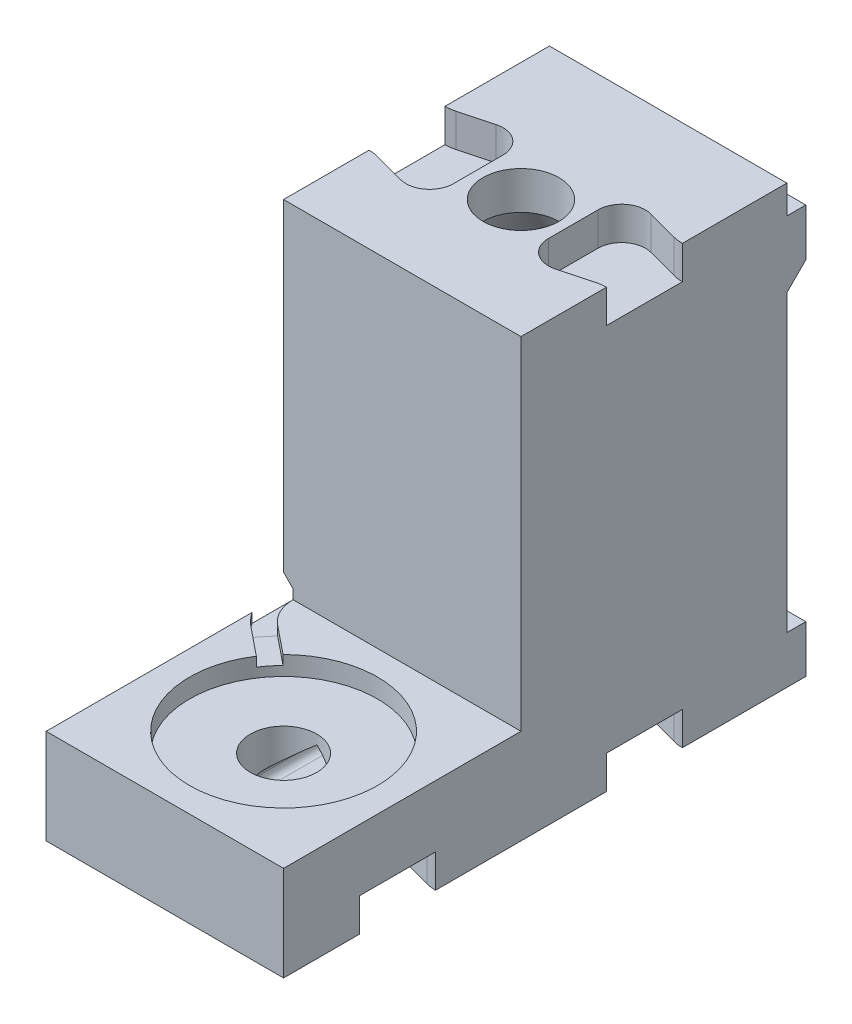
from build123d import *

# Parameters (mm, degrees)
SKETCH2_W                                = 25
SKETCH2_H                                = 53
BOSS_EXTRUDE1_DEPTH                      = 10
SKETCH4_R                                = 9.9
CUT_EXTRUDE3_DEPTH                       = 2
SKETCH5_R                                = 3.5
CUT_EXTRUDE4_DEPTH                       = 5
CUT_EXTRUDE6_REACH                       = 34.253
CUT_EXTRUDE6_END_RADIUS                  = 3.5
CUT_EXTRUDE6_DIRECTION_2_DEPTH           = 12.5
FILLET1_R                                = 0.75
FILLET2_R                                = 0.75
SKETCH9_W                                = 25
SKETCH9_H                                = 28
BOSS_EXTRUDE2_DEPTH                      = 36
FILLET3_R                                = 0.75
FILLET4_R                                = 2
SKETCH12_W                               = 2
SKETCH12_H                               = 2
CUT_EXTRUDE7_DEPTH                       = 2
CHAMFER1_SIZE                            = 1
SKETCH17_W                               = 4
SKETCH17_H                               = 2
SKETCH17_W_2                             = 8
CUT_EXTRUDE9_DEPTH                       = 2
CHAMFER2_SIZE                            = 2
CUT_EXTRUDE10_DEPTH                      = 3.5
MIRROR1_AT_THE_SECOND_PLANE_COPY_1_DEPTH = 3.5
MIRROR2_COPY_1_DEPTH                     = 3.5
MIRROR2_COPY_2_DEPTH                     = 3.5
MIRROR2_COPY_3_DEPTH                     = 3.5
MIRROR2_COPY_4_DEPTH                     = 3.5
BOSS_EXTRUDE3_DEPTH                      = 2
BOSS_EXTRUDE4_DEPTH                      = 2.4
BOSS_EXTRUDE5_DEPTH                      = 5
CHAMFER4_SIZE                            = 0.5


# Some blends are built 0.0001 mm under size
with BuildPart() as part:
    # Sketch2 → Boss-Extrude1 (new body)
    with BuildSketch(Plane(origin=(0, 0, 0), x_dir=(1, 0, 0), z_dir=(0, 1, 0))):
        with Locations((0, 1.5)):
            Rectangle(SKETCH2_W, SKETCH2_H)
    extrude(amount=-BOSS_EXTRUDE1_DEPTH)

    # Sketch4 → Cut-Extrude3 (cut)
    with BuildSketch(Plane(origin=(0, 0, 0), x_dir=(1, 0, 0), z_dir=(0, 1, 0))):
        with Locations(Location((0, -12.5, 0), (0, 0, 270))):
            Circle(SKETCH4_R)
    extrude(amount=-CUT_EXTRUDE3_DEPTH, mode=Mode.SUBTRACT)

    # Sketch5 → Cut-Extrude4 (cut)
    with BuildSketch(Plane(origin=(0, -2, 0), x_dir=(1, 0, 0), z_dir=(0, 1, 0))):
        with Locations(Location((0, -12.5, 0), (0, 0, 270))):
            Circle(SKETCH5_R)
    extrude(amount=-CUT_EXTRUDE4_DEPTH, mode=Mode.SUBTRACT)

    # Cut-Extrude6: up to this cylinder (the profile starts outside it)
    cut_extrude6_end = Plane(origin=(0, -5.592254, 12.5), z_dir=(0, 1, 0)) * Cylinder(CUT_EXTRUDE6_END_RADIUS, 76.506, mode=Mode.PRIVATE)
    # Sketch6 → Cut-Extrude6 (cut, up to the surface)
    with BuildSketch(Plane.XY, mode=Mode.PRIVATE) as cut_extrude6_sk1:
        Polygon((0, -3), (-3.5, -5.936848709), (-3.5, -7), (3.5, -7), (3.5, -5.936848709), align=None)
    cut_extrude6_tool1 = extrude(cut_extrude6_sk1.sketch, amount=CUT_EXTRUDE6_REACH, mode=Mode.PRIVATE) - cut_extrude6_end
    add(cut_extrude6_tool1.solids().sort_by_distance((0, -5.592254, 0))[0], mode=Mode.SUBTRACT)

    # Sketch6 → Cut-Extrude6 direction 2 (cut)
    with BuildSketch(Plane.XY):
        Polygon((0, -3), (-3.5, -5.936848709), (-3.5, -7), (3.5, -7), (3.5, -5.936848709), align=None)
    extrude(amount=-CUT_EXTRUDE6_DIRECTION_2_DEPTH, mode=Mode.SUBTRACT)

    # Sketch8 → Cut-Revolve1 (revolve, cut)
    with BuildSketch(Plane(origin=(0, 0, 0), x_dir=(0, 0, -1), z_dir=(1, 0, 0))):
        Polygon((12.5, 0), (12.5, -7), (16, -7), (16, -2), (22.5, 0), align=None)
    revolve(axis=Axis((0, -8.247089088, -12.5), (0, 1, 0)), mode=Mode.SUBTRACT)

    # Fillet1
    fillet1_edges = [part.edges().sort_by_distance(p)[0] for p in [
        (2.474873734, -7, 14.974873734),
        (-3.5, -7, 0),
        (3.5, -7, 0),
        (2.474873734, -7, -14.974873734),
    ]]
    fillet(fillet1_edges, radius=FILLET1_R)

    # Fillet2
    # the kernel refuses this fillet: 0.75 mm, written as the material it adds along each edge
    with BuildSketch(Plane(origin=(3.5, -5.936848709, -13.374326859), x_dir=(0, -1, 0), z_dir=(0, 0, 1))) as fillet2_piece_1_section:
        with BuildLine():
            CenterArc((FILLET2_R * 0.466307658155, -FILLET2_R), FILLET2_R, 90, 50)
            Line((-FILLET2_R * 0.299736784964, -FILLET2_R * 0.357212390313), (0, 0))
            Line((0, 0), (FILLET2_R * 0.466307658155, 0))
        make_face()
    fillet2_piece_1 = extrude(amount=26.748653718, mode=Mode.PRIVATE)
    fillet2_piece_1 = fillet2_piece_1 - Plane(origin=(0, -5.969679039, -12.5), x_dir=(0, 0, -1), z_dir=(0, 1, 0)) * Cylinder(3.5, 55, mode=Mode.PRIVATE)
    fillet2_piece_1 = fillet2_piece_1 - Plane(origin=(0, -5.969679039, 12.5), x_dir=(0, 0, 1), z_dir=(0, 1, 0)) * Cylinder(3.5, 55, mode=Mode.PRIVATE)
    add(fillet2_piece_1)
    with BuildSketch(Plane(origin=(-3.5, -5.936848709, -13.374326859), x_dir=(0.7660444431189801, 0.6427876096865369, 0), z_dir=(0, 0, 1))) as fillet2_piece_2_section:
        with BuildLine():
            CenterArc((FILLET2_R * 0.466307658155, -FILLET2_R), FILLET2_R, 90, 50)
            Line((-FILLET2_R * 0.299736784964, -FILLET2_R * 0.357212390313), (0, 0))
            Line((0, 0), (FILLET2_R * 0.466307658155, 0))
        make_face()
    fillet2_piece_2 = extrude(amount=26.748653718, mode=Mode.PRIVATE)
    fillet2_piece_2 = fillet2_piece_2 - Plane(origin=(0, -5.96967914, -12.5), x_dir=(0, 0, -1), z_dir=(0, 1, 0)) * Cylinder(3.5, 55, mode=Mode.PRIVATE)
    fillet2_piece_2 = fillet2_piece_2 - Plane(origin=(0, -5.96967914, 12.5), x_dir=(0, 0, 1), z_dir=(0, 1, 0)) * Cylinder(3.5, 55, mode=Mode.PRIVATE)
    add(fillet2_piece_2)

    # Sketch9 → Boss-Extrude2 (add)
    with BuildSketch(Plane(origin=(0, 0, 0), x_dir=(1, 0, 0), z_dir=(0, 1, 0))):
        with Locations((0, 14)):
            Rectangle(SKETCH9_W, SKETCH9_H)
    extrude(amount=BOSS_EXTRUDE2_DEPTH)

    # Sketch10 → Cut-Revolve2 (revolve, cut)
    with BuildSketch(Plane(origin=(0, 0, 0), x_dir=(0, 0, -1), z_dir=(1, 0, 0))):
        Polygon((12.5, 0), (12.5, 36), (16.5, 36), (16.5, 32), (22.5, 21.607695155), (22.5, 0), align=None)
    revolve(axis=Axis((0, -8.247089088, -12.5), (0, 1, 0)), mode=Mode.SUBTRACT)

    # Fillet3
    fillet3_edges = [part.edges().sort_by_distance(p)[0] for p in [
        (0, -2, -9),
    ]]
    fillet(fillet3_edges, radius=FILLET3_R)

    # Fillet4
    fillet4_edges = [part.edges().sort_by_distance(p)[0] for p in [
        (0, 0, -2.5),
        (0, 21.607695155, -2.5),
    ]]
    fillet(fillet4_edges, radius=FILLET4_R)

    # Cut-Sweep1: sweep along a path in Sketch11
    with BuildLine(Plane(origin=(0, 0, 0), x_dir=(1, 0, 0), z_dir=(0, 1, 0))) as cut_sweep1_path:
        Line((-12.5, 28), (-12.5, 0))
        ThreePointArc((-12.5, 0), (-12.012487896, -2.153474631), (-10.645018805, -3.887011283))
        Line((-10.645018805, -3.887011283), (0, -12.5))
    # Sketch12 → Cut-Sweep1 (sweep, cut)
    with BuildSketch(Plane(origin=(0, 0, -28), x_dir=(-1, 0, 0), z_dir=(0, 0, -1))):
        with Locations((12.5, 0)):
            Rectangle(SKETCH12_W, SKETCH12_H)
    sweep(path=cut_sweep1_path.line, mode=Mode.SUBTRACT)

    # Sketch14 → Cut-Extrude7 (cut)
    with BuildSketch(Plane(origin=(0, 0, -28), x_dir=(-1, 0, 0), z_dir=(0, 0, -1))):
        with BuildLine():
            Line((-10.1, -7), (-2.15, -7))
            ThreePointArc((-2.15, -7), (0, -9.15), (2.15, -7))
            Line((2.15, -7), (10.1, -7))
            Line((10.1, -7), (10.1, 20.85))
            ThreePointArc((10.1, 20.85), (12.25, 23), (10.1, 25.15))
            Line((10.1, 25.15), (10.1, 33))
            Line((10.1, 33), (-10.1, 33))
            Line((-10.1, 33), (-10.1, 25.15))
            ThreePointArc((-10.1, 25.15), (-12.25, 23), (-10.1, 20.85))
            Line((-10.1, 20.85), (-10.1, -7))
        make_face()
    extrude(amount=-CUT_EXTRUDE7_DEPTH, mode=Mode.SUBTRACT)

    # Chamfer1
    chamfer1_edges = [part.edges().sort_by_distance(p)[0] for p in [
        (-12.5, 1, -14),
    ]]
    chamfer(chamfer1_edges, length=CHAMFER1_SIZE - 0.0001)  # a hair under: the kernel refuses the full size

    # Sketch17 → Cut-Extrude9 (cut)
    with BuildSketch(Plane(origin=(0, 0, -26), x_dir=(-1, 0, 0), z_dir=(0, 0, -1))):
        with Locations((0, -2.5)):
            Rectangle(SKETCH17_W, SKETCH17_H)
        with Locations((0, 29.5)):
            Rectangle(SKETCH17_W_2, SKETCH17_H)
    extrude(amount=-CUT_EXTRUDE9_DEPTH, mode=Mode.SUBTRACT)

    # Chamfer2
    chamfer2_edges = [part.edges().sort_by_distance(p)[0] for p in [
        (0, -1.5, -26),
        (0, 30.5, -26),
        (0, 33, -28),
    ]]
    chamfer(chamfer2_edges, length=CHAMFER2_SIZE - 0.0001)  # a hair under: the kernel refuses the full size

    # Sketch18 → Cut-Extrude10 (cut)
    with BuildSketch(Plane.XZ.offset(10)):
        with BuildLine():
            Line((-11.46472382, 8.863703305), (-8.147047613, 7.974734645))
            ThreePointArc((-8.147047613, 7.974734645), (-5.978096427, 8.40616586), (-5, 10.389549211))
            Line((-5, 10.389549211), (-5, 15.610450789))
            ThreePointArc((-5, 15.610450789), (-5.978096427, 17.59383414), (-8.147047613, 18.025265355))
            Line((-8.147047613, 18.025265355), (-11.46472382, 17.136296695))
            ThreePointArc((-11.46472382, 17.136296695), (-11.977895231, 17.034220555), (-12.5, 17))
            Line((-12.5, 17), (-12.5, 9))
            ThreePointArc((-12.5, 9), (-11.977895231, 8.965779445), (-11.46472382, 8.863703305))
        make_face()
    cut_extrude10 = extrude(amount=-CUT_EXTRUDE10_DEPTH, mode=Mode.SUBTRACT)

    # Mirror1: Cut-Extrude10 across plane
    add(cut_extrude10.mirror(Plane.XY), mode=Mode.SUBTRACT)

    # Mirror1 at the second plane: Cut-Extrude10 across plane
    add(cut_extrude10.mirror(Plane(origin=(0, 0, 0), x_dir=(0, 0, 1), z_dir=(1, 0, 0))), mode=Mode.SUBTRACT)

    # Mirror1 at the second plane copy 1 sketc → Mirror1 at the second plane copy 1 (cut)
    with BuildSketch(Plane(origin=(0, -10, 0), x_dir=(-1, 0, 0), z_dir=(0, -1, 0))):
        with BuildLine():
            Line((-11.46472382, 8.863703305), (-8.147047613, 7.974734645))
            ThreePointArc((-8.147047613, 7.974734645), (-5.978096427, 8.40616586), (-5, 10.389549211))
            Line((-5, 10.389549211), (-5, 15.610450789))
            ThreePointArc((-5, 15.610450789), (-5.978096427, 17.59383414), (-8.147047613, 18.025265355))
            Line((-8.147047613, 18.025265355), (-11.46472382, 17.136296695))
            ThreePointArc((-11.46472382, 17.136296695), (-11.977895231, 17.034220555), (-12.5, 17))
            Line((-12.5, 17), (-12.5, 9))
            ThreePointArc((-12.5, 9), (-11.977895231, 8.965779445), (-11.46472382, 8.863703305))
        make_face()
    extrude(amount=-MIRROR1_AT_THE_SECOND_PLANE_COPY_1_DEPTH, mode=Mode.SUBTRACT)

    # Mirror2 copy 1 sketch → Mirror2 copy 1 (cut)
    with BuildSketch(Plane(origin=(0, 36, 0), x_dir=(1, 0, 0), z_dir=(0, 1, 0))):
        with BuildLine():
            Line((-11.46472382, 8.863703305), (-8.147047613, 7.974734645))
            ThreePointArc((-8.147047613, 7.974734645), (-5.978096427, 8.40616586), (-5, 10.389549211))
            Line((-5, 10.389549211), (-5, 15.610450789))
            ThreePointArc((-5, 15.610450789), (-5.978096427, 17.59383414), (-8.147047613, 18.025265355))
            Line((-8.147047613, 18.025265355), (-11.46472382, 17.136296695))
            ThreePointArc((-11.46472382, 17.136296695), (-11.977895231, 17.034220555), (-12.5, 17))
            Line((-12.5, 17), (-12.5, 9))
            ThreePointArc((-12.5, 9), (-11.977895231, 8.965779445), (-11.46472382, 8.863703305))
        make_face()
    extrude(amount=-MIRROR2_COPY_1_DEPTH, mode=Mode.SUBTRACT)

    # Mirror2 copy 2 sketch → Mirror2 copy 2 (cut)
    with BuildSketch(Plane(origin=(0, 36, 0), x_dir=(-1, 0, 0), z_dir=(0, 1, 0))):
        with BuildLine():
            Line((-11.46472382, 8.863703305), (-8.147047613, 7.974734645))
            ThreePointArc((-8.147047613, 7.974734645), (-5.978096427, 8.40616586), (-5, 10.389549211))
            Line((-5, 10.389549211), (-5, 15.610450789))
            ThreePointArc((-5, 15.610450789), (-5.978096427, 17.59383414), (-8.147047613, 18.025265355))
            Line((-8.147047613, 18.025265355), (-11.46472382, 17.136296695))
            ThreePointArc((-11.46472382, 17.136296695), (-11.977895231, 17.034220555), (-12.5, 17))
            Line((-12.5, 17), (-12.5, 9))
            ThreePointArc((-12.5, 9), (-11.977895231, 8.965779445), (-11.46472382, 8.863703305))
        make_face()
    extrude(amount=-MIRROR2_COPY_2_DEPTH, mode=Mode.SUBTRACT)

    # Mirror2 copy 3 sketch → Mirror2 copy 3 (cut)
    with BuildSketch(Plane(origin=(0, 36, 0), x_dir=(-1, 0, 0), z_dir=(0, 1, 0))):
        with BuildLine():
            Line((-11.46472382, -8.863703305), (-8.147047613, -7.974734645))
            ThreePointArc((-8.147047613, -7.974734645), (-5.978096427, -8.40616586), (-5, -10.389549211))
            Line((-5, -10.389549211), (-5, -15.610450789))
            ThreePointArc((-5, -15.610450789), (-5.978096427, -17.59383414), (-8.147047613, -18.025265355))
            Line((-8.147047613, -18.025265355), (-11.46472382, -17.136296695))
            ThreePointArc((-11.46472382, -17.136296695), (-11.977895231, -17.034220555), (-12.5, -17))
            Line((-12.5, -17), (-12.5, -9))
            ThreePointArc((-12.5, -9), (-11.977895231, -8.965779445), (-11.46472382, -8.863703305))
        make_face()
    extrude(amount=-MIRROR2_COPY_3_DEPTH, mode=Mode.SUBTRACT)

    # Mirror2 copy 4 sketch → Mirror2 copy 4 (cut)
    with BuildSketch(Plane(origin=(0, 36, 0), x_dir=(1, 0, 0), z_dir=(0, 1, 0))):
        with BuildLine():
            Line((-11.46472382, -8.863703305), (-8.147047613, -7.974734645))
            ThreePointArc((-8.147047613, -7.974734645), (-5.978096427, -8.40616586), (-5, -10.389549211))
            Line((-5, -10.389549211), (-5, -15.610450789))
            ThreePointArc((-5, -15.610450789), (-5.978096427, -17.59383414), (-8.147047613, -18.025265355))
            Line((-8.147047613, -18.025265355), (-11.46472382, -17.136296695))
            ThreePointArc((-11.46472382, -17.136296695), (-11.977895231, -17.034220555), (-12.5, -17))
            Line((-12.5, -17), (-12.5, -9))
            ThreePointArc((-12.5, -9), (-11.977895231, -8.965779445), (-11.46472382, -8.863703305))
        make_face()
    extrude(amount=-MIRROR2_COPY_4_DEPTH, mode=Mode.SUBTRACT)

    # Sketch19 → Boss-Extrude3 (add)
    with BuildSketch(Plane(origin=(0, 0, -28), x_dir=(-1, 0, 0), z_dir=(0, 0, -1))):
        Polygon((-12.5, -10), (-12.5, -5), (-5.5, -5), (-3.5, -7), (3.5, -7), (5.5, -5), (12.5, -5), (12.5, -10), align=None)
    extrude(amount=BOSS_EXTRUDE3_DEPTH)

    # Sketch20 → Boss-Extrude4 (add)
    with BuildSketch(Plane(origin=(12.5, 0, 0), x_dir=(0, 0, -1), z_dir=(1, 0, 0))):
        Polygon((28, 33), (30, 33), (30, 28), (28, 26), align=None)
    boss_extrude4 = extrude(amount=-BOSS_EXTRUDE4_DEPTH)

    # Sketch23 → Boss-Extrude5 (add)
    with BuildSketch(Plane(origin=(0, 33, 0), x_dir=(1, 0, 0), z_dir=(0, 1, 0))):
        Polygon((10.1, 30), (9.75, 29.393782217), (9.75, 28.202072594), (10.1, 28), align=None)
    boss_extrude5 = extrude(amount=-BOSS_EXTRUDE5_DEPTH)

    # Mirror6: Boss-Extrude4, Boss-Extrude5 across plane
    add(boss_extrude4.mirror(Plane(origin=(0, 0, 0), x_dir=(0, 0, 1), z_dir=(1, 0, 0))))
    add(boss_extrude5.mirror(Plane(origin=(0, 0, 0), x_dir=(0, 0, 1), z_dir=(1, 0, 0))))

    # Chamfer4
    # the kernel refuses this chamfer: 0.5 mm, written as the material it adds along each edge
    with BuildSketch(Plane(origin=(-10.1, 28, -26.714158506), x_dir=(-0.02749587661058555, -0.9996219169112968, 0), z_dir=(0, 0, -1))) as chamfer4_piece_1_section:
        Polygon((CHAMFER4_SIZE * 0.999621916911, -CHAMFER4_SIZE * 0.0274958766106), (-CHAMFER4_SIZE * 0.0274958766106, -CHAMFER4_SIZE * 0.999621916911), (0, 0), align=None)
    chamfer4_piece_1 = extrude(amount=4.571682988, mode=Mode.PRIVATE)
    chamfer4_piece_1 = split(chamfer4_piece_1, bisect_by=Plane(origin=(-9.972337658, 27.353509408, -29.353509408), z_dir=(0, 0.7071067811865438, 0.7071067811865513)), keep=Keep.TOP, mode=Mode.PRIVATE)
    chamfer4_piece_1 = split(chamfer4_piece_1, bisect_by=Plane(origin=(-9.620361672, 27.820459208, -28.276919318), z_dir=(-0.49999999999999833, 0, -0.8660254037844396)), keep=Keep.TOP, mode=Mode.PRIVATE)
    chamfer4_piece_1 = split(chamfer4_piece_1, bisect_by=Plane(origin=(-9.585950582, 27.820459208, -29.10964029), z_dir=(-0.8660254037844377, 0, 0.5000000000000017)), keep=Keep.TOP, mode=Mode.PRIVATE)
    chamfer4_piece_1 = split(chamfer4_piece_1, bisect_by=Plane(origin=(-9.75, 27.820459208, -28.886559608), z_dir=(-1, 0, 0)), keep=Keep.TOP, mode=Mode.PRIVATE)
    add(chamfer4_piece_1)
    with BuildSketch(Plane(origin=(10.1, 28, -26.714158506), x_dir=(0.02749587661058555, -0.9996219169112968, 0), z_dir=(0, 0, -1))) as chamfer4_piece_2_section:
        Polygon((CHAMFER4_SIZE * 0.999621916911, CHAMFER4_SIZE * 0.0274958766106), (-CHAMFER4_SIZE * 0.0274958766106, CHAMFER4_SIZE * 0.999621916911), (0, 0), align=None)
    chamfer4_piece_2 = extrude(amount=4.571682988, mode=Mode.PRIVATE)
    chamfer4_piece_2 = split(chamfer4_piece_2, bisect_by=Plane(origin=(9.620361672, 27.820459208, -28.276919318), z_dir=(0.49999999999999833, 0, -0.8660254037844396)), keep=Keep.TOP, mode=Mode.PRIVATE)
    chamfer4_piece_2 = split(chamfer4_piece_2, bisect_by=Plane(origin=(9.972337658, 27.353509408, -29.353509408), z_dir=(0, 0.7071067811865438, 0.7071067811865513)), keep=Keep.TOP, mode=Mode.PRIVATE)
    chamfer4_piece_2 = split(chamfer4_piece_2, bisect_by=Plane(origin=(9.585950582, 27.820459208, -29.10964029), z_dir=(0.8660254037844377, 0, 0.5000000000000017)), keep=Keep.TOP, mode=Mode.PRIVATE)
    chamfer4_piece_2 = split(chamfer4_piece_2, bisect_by=Plane(origin=(9.75, 27.820459208, -28.886559608), z_dir=(1, 0, 0)), keep=Keep.TOP, mode=Mode.PRIVATE)
    add(chamfer4_piece_2)


solid = part.part
